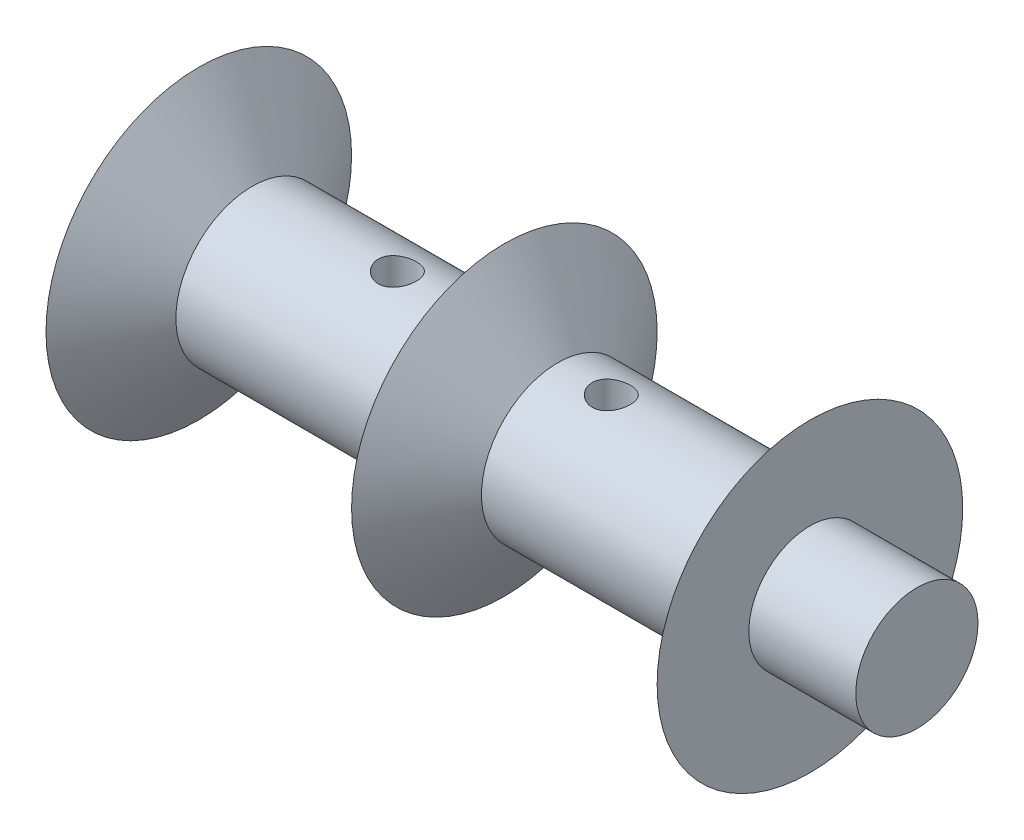
from build123d import *

# Parameters (mm, degrees)
CUT_EXTRUDE1_DEPTH      = 9
SKETCH3_R               = 2.5
CUT_EXTRUDE2_DEPTH      = 2.5
SKETCH4_R               = 4
BOSS_EXTRUDE1_DEPTH     = 7
CUT_EXTRUDE3_DEPTH      = 31.479501308
CUT_EXTRUDE3_DEPTH_BACK = 31.479501308
SKETCH5_R               = 1.25


with BuildPart() as part:
    # Sketch1 → Revolve1 (revolve)
    with BuildSketch(Plane.XY):
        Polygon((20, 0), (-20, 0), (-20, 10), (-16.5, 5), (-3.5, 5), (0, 10), (3.5, 5), (16.5, 5), (20, 10), align=None)
    revolve(axis=Axis((20, 0, 0), (-1, 0, 0)))

    # Sketch2 → Cut-Extrude1 (cut)
    with BuildSketch(Plane.ZY.offset(20)):
        with BuildLine():
            ThreePointArc((1.5, 2), (0, 2.5), (-1.5, 2))
            Line((-1.5, 2), (-1.5, -2))
            ThreePointArc((-1.5, -2), (0, -2.5), (1.5, -2))
            Line((1.5, -2), (1.5, 2))
        make_face()
    extrude(amount=-CUT_EXTRUDE1_DEPTH, mode=Mode.SUBTRACT)

    # Sketch3 → Cut-Extrude2 (cut)
    with BuildSketch(Plane.ZY.offset(20)):
        Circle(SKETCH3_R)
    extrude(amount=-CUT_EXTRUDE2_DEPTH, mode=Mode.SUBTRACT)

    # Sketch4 → Boss-Extrude1 (add)
    with BuildSketch(Plane(origin=(20, 0, 0), x_dir=(0, 0, -1), z_dir=(1, 0, 0))):
        Circle(SKETCH4_R)
    extrude(amount=BOSS_EXTRUDE1_DEPTH)

    # Sketch5 → Cut-Extrude3 (cut, two sides: drawn at the far end of the back side and taken through both)
    with BuildSketch(Plane(origin=(0, 0, 0), x_dir=(1, 0, 0), z_dir=(0, 1, 0)).offset(-CUT_EXTRUDE3_DEPTH_BACK)):
        with Locations((-7, 0)):
            Circle(SKETCH5_R)
        with Locations((7, 0)):
            Circle(SKETCH5_R)
    extrude(amount=CUT_EXTRUDE3_DEPTH + CUT_EXTRUDE3_DEPTH_BACK, mode=Mode.SUBTRACT)


solid = part.part
